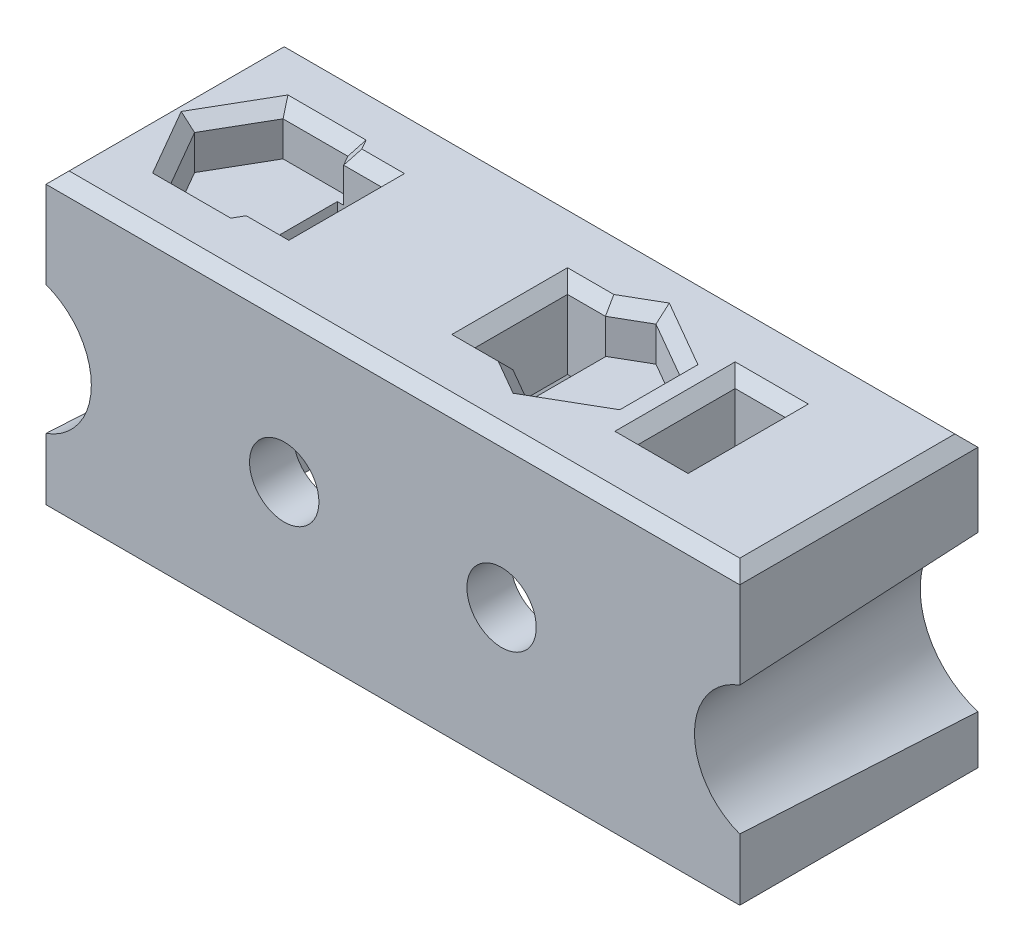
from build123d import *

# Parameters (mm, degrees)
SKETCH1_W                    = 30
SKETCH1_H                    = 10.3
SKETCH1_W_2                  = 21
SKETCH1_H_2                  = 6.3
BOSS_EXTRUDE1_DEPTH          = 10.5
F_3_0_3_DIAMETER_HOLE1_D     = 3
SKETCH4_W                    = 30
SKETCH4_H                    = 10.3
SKETCH4_R                    = 2.425
BOSS_EXTRUDE2_DEPTH          = 2
CUT_EXTRUDE2_START           = -4
CUT_EXTRUDE2_DEPTH           = 4
CUT_EXTRUDE3_START           = -4
CUT_EXTRUDE3_DEPTH           = 4
MOVE_START                   = -10.6
MOVE_FACE1_OUTLINE_W         = 10.5
MOVE_FACE1_OUTLINE_H         = 6.5
MOVE_FACE1_DEPTH             = 21.2
MOVE_START_2                 = 7.55
MOVE_FACE1_2_OUTLINE_W       = 2
MOVE_FACE1_2_OUTLINE_H       = 4.2
MOVE_FACE1_2_DEPTH           = 2.162306716
BOSS_EXTRUDE3_START          = 1.5
BOSS_EXTRUDE3_DEPTH          = 1.5
CUT_EXTRUDE4_DEPTH           = 2
DELETEFACE1_START            = 10.5
DELETEFACE1_DEPTH            = 2
CHAMFER1_SIZE                = 0.5
SKETCH10_R                   = 3.5
CUT_EXTRUDE5_DEPTH           = 10.3
CUT_EXTRUDE5_DRAFT           = -3
CUT_EXTRUDE5_PROFILE_2_DEPTH = 10.3
CUT_EXTRUDE5_PROFILE_2_DRAFT = -3


# Read off the part's stored shape, not the designer's step: Move Face1, DeleteFace1
with BuildPart() as part:
    # Sketch1 → Boss-Extrude1 (new body)
    with BuildSketch(Plane(origin=(0, 0, 0), x_dir=(1, 0, 0), z_dir=(0, 1, 0))):
        Rectangle(SKETCH1_W, SKETCH1_H)
        Rectangle(SKETCH1_W_2, SKETCH1_H_2, mode=Mode.SUBTRACT)
    extrude(amount=BOSS_EXTRUDE1_DEPTH)

    # Ø3.0 (3) Diameter Hole1 (through all)
    with Locations(Plane.XY.offset(5.15)):
        with Locations((-4.699, 6), (4.699, 6)):
            Hole(F_3_0_3_DIAMETER_HOLE1_D / 2)

    # Sketch4 → Boss-Extrude2 (add)
    with BuildSketch(Plane(origin=(0, 10.5, 0), x_dir=(1, 0, 0), z_dir=(0, 1, 0))):
        Rectangle(SKETCH4_W, SKETCH4_H)
        with Locations(Location((-10.925, 0, 0), (0, 0, 79.906343141))):
            Circle(SKETCH4_R, mode=Mode.SUBTRACT)
        with Locations(Location((10.925, 0, 0), (0, 0, 100.093656859))):
            Circle(SKETCH4_R, mode=Mode.SUBTRACT)
        with Locations(Location((3.425, 0, 0), (0, 0, 270))):
            Circle(SKETCH4_R, mode=Mode.SUBTRACT)
    extrude(amount=BOSS_EXTRUDE2_DEPTH)

    # Sketch5 → Cut-Extrude2 (cut)
    with BuildSketch(Plane(origin=(0, 12.5, 0), x_dir=(1, 0, 0), z_dir=(0, 1, 0)).offset(CUT_EXTRUDE2_START)):
        with BuildLine():
            Line((-7.65, 2), (-8.4, 2))
            Line((-8.4, 2), (-9.553641185, 2))
            ThreePointArc((-9.553641185, 2), (-8.779519852, 1.130283122), (-8.5, 0))
            ThreePointArc((-8.5, 0), (-8.779519852, -1.130283122), (-9.553641185, -2))
            Line((-9.553641185, -2), (-8.4, -2))
            Line((-8.4, -2), (-7.65, -2))
            Line((-7.65, -2), (-7.65, 2))
        make_face()
    cut_extrude2 = extrude(amount=CUT_EXTRUDE2_DEPTH, mode=Mode.SUBTRACT)

    # Sketch6 → Cut-Extrude3 (cut)
    with BuildSketch(Plane(origin=(0, 12.5, 0), x_dir=(1, 0, 0), z_dir=(0, 1, 0)).offset(CUT_EXTRUDE3_START)):
        with BuildLine():
            Line((2.053641185, 2), (1, 2))
            Line((1, 2), (0.4, 2))
            Line((0.4, 2), (0.4, -2))
            Line((0.4, -2), (1, -2))
            Line((1, -2), (2.053641185, -2))
            ThreePointArc((2.053641185, -2), (1, 0), (2.053641185, 2))
        make_face()
    extrude(amount=CUT_EXTRUDE3_DEPTH, mode=Mode.SUBTRACT)

    # Mirror1: Cut-Extrude2 across plane
    add(cut_extrude2.mirror(Plane(origin=(0, 0, 0), x_dir=(0, 0, 1), z_dir=(1, 0, 0))), mode=Mode.SUBTRACT)

    # Move Face1 outline → Move Face1 (cut)
    with BuildSketch(Plane.YZ.offset(MOVE_START)):
        with Locations((5.25, 0)):
            Rectangle(MOVE_FACE1_OUTLINE_W, MOVE_FACE1_OUTLINE_H)
    extrude(amount=MOVE_FACE1_DEPTH, mode=Mode.SUBTRACT)

    # Move Face1 2 outline → Move Face1 2 (cut)
    with BuildSketch(Plane.YZ.offset(MOVE_START_2)):
        with Locations((11.5, 0)):
            Rectangle(MOVE_FACE1_2_OUTLINE_W, MOVE_FACE1_2_OUTLINE_H)
    extrude(amount=MOVE_FACE1_2_DEPTH, mode=Mode.SUBTRACT)

    # Sketch7 → Boss-Extrude3 (add)
    # profile 1 of 4: a face of its own
    with BuildSketch(Plane.XZ.offset(-10.5).offset(BOSS_EXTRUDE3_START)):
        with BuildLine():
            Line((9.712306716, -2.1), (7.55, -2.1))
            Line((7.55, -2.1), (7.55, 2.1))
            Line((7.55, 2.1), (9.712306716, 2.1))
            ThreePointArc((9.712306716, 2.1), (10.141357197, 2.294891927), (10.6, 2.403122968))
            Line((10.6, 2.403122968), (10.6, 3.25))
            Line((10.6, 3.25), (-10.6, 3.25))
            Line((-10.6, 3.25), (-10.6, 2.403122968))
            ThreePointArc((-10.6, 2.403122968), (-10.053199943, 2.262871994), (-9.553641185, 2))
            Line((-9.553641185, 2), (-7.65, 2))
            Line((-7.65, 2), (-7.65, -2))
            Line((-7.65, -2), (-9.553641185, -2))
            ThreePointArc((-9.553641185, -2), (-10.053199943, -2.262871994), (-10.6, -2.403122968))
            Line((-10.6, -2.403122968), (-10.6, -3.25))
            Line((-10.6, -3.25), (10.6, -3.25))
            Line((10.6, -3.25), (10.6, -2.403122968))
            ThreePointArc((10.6, -2.403122968), (10.141357197, -2.294891927), (9.712306716, -2.1))
        make_face()
        with BuildLine():
            Line((0.4, -2), (0.4, 2))
            Line((0.4, 2), (2.053641185, 2))
            ThreePointArc((2.053641185, 2), (5.85, 0), (2.053641185, -2))
            Line((2.053641185, -2), (0.4, -2))
        make_face(mode=Mode.SUBTRACT)
    # profile 2 of 4: a face of its own
    with BuildSketch(Plane.XZ.offset(-10.5).offset(BOSS_EXTRUDE3_START)):
        with BuildLine():
            Line((2.053641185, 2), (2.053641185, -2))
            ThreePointArc((2.053641185, -2), (5.85, 0), (2.053641185, 2))
        make_face()
    # profile 3 of 4: a face of its own
    with BuildSketch(Plane.XZ.offset(-10.5).offset(BOSS_EXTRUDE3_START)):
        with BuildLine():
            Line((-9.553641185, 2), (-9.553641185, -2))
            ThreePointArc((-9.553641185, -2), (-10.053199943, -2.262871994), (-10.6, -2.403122968))
            Line((-10.6, -2.403122968), (-10.6, 2.403122968))
            ThreePointArc((-10.6, 2.403122968), (-10.053199943, 2.262871994), (-9.553641185, 2))
        make_face()
    # profile 4 of 4: a face of its own
    with BuildSketch(Plane.XZ.offset(-10.5).offset(BOSS_EXTRUDE3_START)):
        with BuildLine():
            Line((10.6, 2.403122968), (10.6, -2.403122968))
            ThreePointArc((10.6, -2.403122968), (10.141357197, -2.294891927), (9.712306716, -2.1))
            Line((9.712306716, -2.1), (9.712306716, 2.1))
            ThreePointArc((9.712306716, 2.1), (10.141357197, 2.294891927), (10.6, 2.403122968))
        make_face()
    extrude(amount=-BOSS_EXTRUDE3_DEPTH)

    # Sketch9 → Cut-Extrude4 (cut)
    with BuildSketch(Plane(origin=(0, 12.5, 0), x_dir=(1, 0, 0), z_dir=(0, 1, 0))):
        Polygon((-12.325074403, 2.425), (-13.725148806, 0), (-12.325074403, -2.425), (-9.524925597, -2.425), (-8.124851194, 0), (-9.524925597, 2.425), align=None)
        Polygon((1, 1.400074403), (1, -1.400074403), (3.425, -2.800148806), (5.85, -1.400074403), (5.85, 1.400074403), (3.425, 2.800148806), align=None)
        Polygon((11.64973184, 2.704736049), (8.944995791, 1.980004209), (8.220263951, -0.72473184), (10.20026816, -2.704736049), (12.905004209, -1.980004209), (13.629736049, 0.72473184), align=None)
    extrude(amount=-CUT_EXTRUDE4_DEPTH, mode=Mode.SUBTRACT)

    # DeleteFace1 outline → DeleteFace1 (add)
    with BuildSketch(Plane(origin=(0, 0, 0), x_dir=(1, 0, 0), z_dir=(0, 1, 0)).offset(DELETEFACE1_START)):
        Polygon((9.392826181, 2.1), (9.712306716, 2.1), (9.712306716, -2.1), (9.595532111, -2.1), (10.20026816, -2.704736049), (12.905004209, -1.980004209), (13.629736049, 0.72473184), (11.64973184, 2.704736049), align=None)
    extrude(amount=DELETEFACE1_DEPTH)

    # Chamfer1
    chamfer1_edges = [part.edges().sort_by_distance(p)[0] for p in [
        (8.631153358, 12.5, 2.1),
        (7.55, 12.5, 0),
        (8.631153358, 12.5, -2.1),
        (1.219550808, 12.5, 2),
        (-8.464775866, 12.5, -2),
        (-10.925, 12.5, 2.425),
        (-9.402238665, 12.5, 2.2125),
        (-13.025111604, 12.5, 1.2125),
        (-13.025111604, 12.5, -1.2125),
        (-10.925, 12.5, -2.425),
        (-9.402238665, 12.5, -2.2125),
        (2.732050808, 12.5, 2.400074403),
        (4.6375, 12.5, 2.100111604),
        (5.85, 12.5, 0),
        (4.6375, 12.5, -2.100111604),
        (2.732050808, 12.5, -2.400074403),
        (9.712306716, 12.5, 0),
        (0, 12.5, -5.15),
        (-15, 12.5, 0),
        (0, 12.5, 5.15),
        (15, 12.5, 0),
        (-7.65, 12.5, 0),
        (-8.464775866, 12.5, 2),
        (0.4, 12.5, 0),
        (1.219550808, 12.5, -2),
    ]]
    chamfer(chamfer1_edges, length=CHAMFER1_SIZE)


with BuildPart() as cut_extrude5_tool:
    # Sketch10 → Cut-Extrude5 (with draft: the straight prism first)
    with BuildSketch(Plane(origin=(0, 0, -5.15), x_dir=(-1, 0, 0), z_dir=(0, 0, -1))):
        with Locations((16, 5.45673788)):
            Circle(SKETCH10_R)
    extrude(amount=-CUT_EXTRUDE5_DEPTH)
    # Cut-Extrude5: the draft: its side faces are tilted about the plane it starts from
    cut_extrude5_sides = [cut_extrude5_tool.faces().sort_by_distance(p)[0] for p in [
        (-12.5, 5.45673788, 0),
    ]]
    draft(cut_extrude5_sides, Plane(origin=(0, 0, -5.15), x_dir=(-1, 0, 0), z_dir=(0, 0, -1)), CUT_EXTRUDE5_DRAFT)


with BuildPart() as part_1:
    add(part.part)

    # Cut-Extrude5: cut by cut_extrude5_tool
    add(cut_extrude5_tool.part, mode=Mode.SUBTRACT)


with BuildPart() as cut_extrude5_profile_2_tool:
    # Sketch10 → Cut-Extrude5 profile 2 (with draft: the straight prism first)
    with BuildSketch(Plane(origin=(0, 0, -5.15), x_dir=(-1, 0, 0), z_dir=(0, 0, -1))):
        with Locations((-16, 5.45673788)):
            Circle(SKETCH10_R)
    extrude(amount=-CUT_EXTRUDE5_PROFILE_2_DEPTH)
    # Cut-Extrude5 profile 2: the draft: its side faces are tilted about the plane it starts from
    cut_extrude5_profile_2_sides = [cut_extrude5_profile_2_tool.faces().sort_by_distance(p)[0] for p in [
        (19.5, 5.45673788, 0),
    ]]
    draft(cut_extrude5_profile_2_sides, Plane(origin=(0, 0, -5.15), x_dir=(-1, 0, 0), z_dir=(0, 0, -1)), CUT_EXTRUDE5_PROFILE_2_DRAFT)


with BuildPart() as part_2:
    add(part_1.part)

    # Cut-Extrude5 profile 2: cut by cut_extrude5_profile_2_tool
    add(cut_extrude5_profile_2_tool.part, mode=Mode.SUBTRACT)


solid = part_2.part
